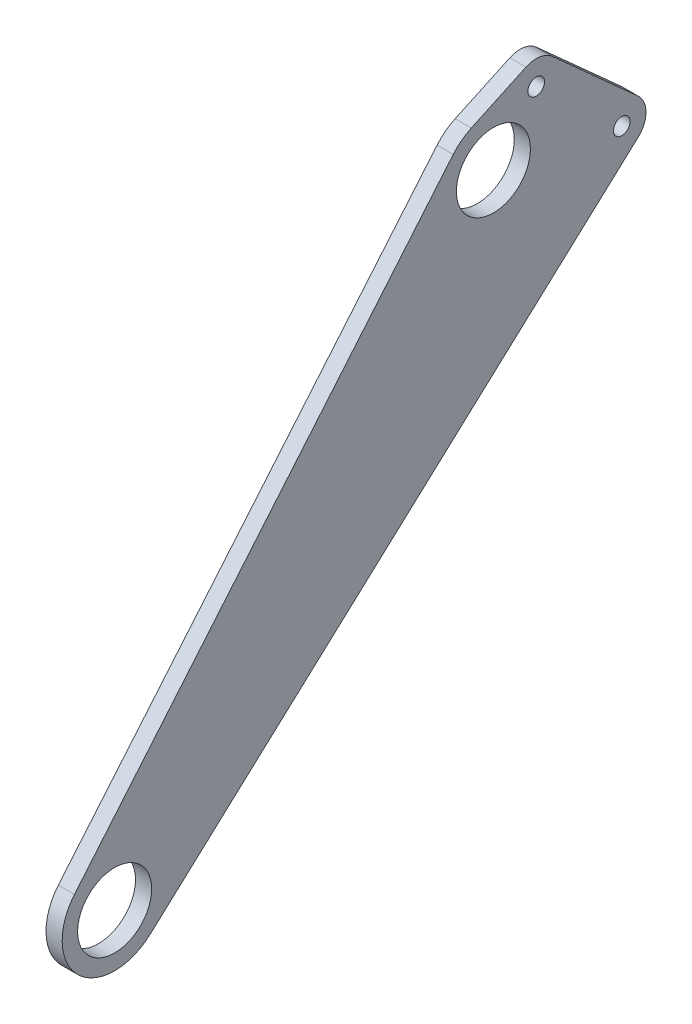
from build123d import *

# Parameters (mm, degrees)
SKETCH1_R           = 14.5542
SKETCH1_R_2         = 3.2639
BOSS_EXTRUDE1_DEPTH = 6.35


with BuildPart() as part:
    # Sketch1 → Boss-Extrude1 (new body)
    with BuildSketch(Plane(origin=(0, 0, 0), x_dir=(0, 0, -1), z_dir=(1, 0, 0))):
        with BuildLine():
            Line((-15.81059753, 13.263913901), (133.153358593, 190.829086165))
            ThreePointArc((133.153358593, 190.829086165), (136.413649914, 193.947974842), (140.273805793, 196.283817874))
            Line((140.273805793, 196.283817874), (161.788085153, 206.271844026))
            ThreePointArc((161.788085153, 206.271844026), (167.21418736, 207.051739481), (172.171515343, 204.711713553))
            Line((172.171515343, 204.711713553), (205.812262342, 174.428998606))
            ThreePointArc((205.812262342, 174.428998606), (208.964596209, 167.387441015), (205.86808218, 160.321158896))
            Line((205.86808218, 160.321158896), (13.92822473, -15.22862312))
            ThreePointArc((13.92822473, -15.22862312), (-14.277324621, -14.901825658), (-15.81059753, 13.263913901))
        make_face()
        Circle(SKETCH1_R, mode=Mode.SUBTRACT)
        with Locations((148.963956123, 177.565172264)):
            Circle(SKETCH1_R, mode=Mode.SUBTRACT)
        with Locations((199.439670766, 167.349754182)):
            Circle(SKETCH1_R_2, mode=Mode.SUBTRACT)
        with Locations((165.798923767, 197.632469129)):
            Circle(SKETCH1_R_2, mode=Mode.SUBTRACT)
    extrude(amount=BOSS_EXTRUDE1_DEPTH)


solid = part.part
